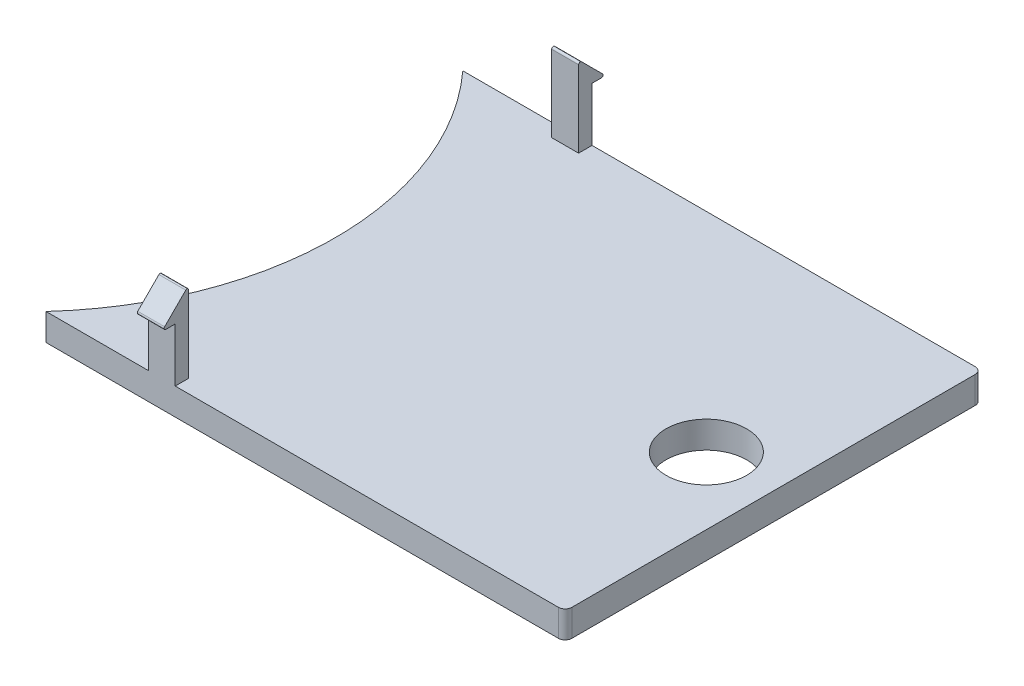
from build123d import *

# Parameters (mm, degrees)
EXTRUDE_1_DEPTH        = 4
EXTRUDE_970_DEPTH      = 2
FILLET_1_R             = 0.25
FILLET_1_OF_MIRROR_1_R = 0.25
SKETCH_4_R             = 6
CUT_EXTRUDE_2_DEPTH    = 53.927628586


with BuildPart() as part:
    # 草图1 → 凸台-拉伸1 (new body)
    with BuildSketch(Plane(origin=(0, 0, 0), x_dir=(1, 0, 0), z_dir=(0, 1, 0))):
        with BuildLine():
            ThreePointArc((38.61, 30), (38.317106781, 30.707106781), (37.61, 31))
            Line((37.61, 31), (-38.61, 31))
            ThreePointArc((-38.61, 31), (-26.595290936, 0), (-38.61, -31))
            Line((-38.61, -31), (37.61, -31))
            ThreePointArc((37.61, -31), (38.317106781, -30.707106781), (38.61, -30))
            Line((38.61, -30), (38.61, 30))
        make_face()
    extrude(amount=EXTRUDE_1_DEPTH)

    # 草图3 → Extrude 970 (add, symmetric)
    with BuildSketch(Plane(origin=(-21.39, 0, 0), x_dir=(0, 0, -1), z_dir=(1, 0, 0))):
        Polygon((-31, 4), (-31, 12), (-33, 12), (-29, 16), (-29, 4), align=None)
    extrude_970 = extrude(amount=EXTRUDE_970_DEPTH, both=True)

    # 圆角1
    fillet_1_edges = [part.edges().sort_by_distance(p)[0] for p in [
        (-21.39, 16, 29),
        (-21.39, 12, 33),
    ]]
    fillet(fillet_1_edges, radius=FILLET_1_R)

    # 镜向1: Extrude 970 across plane
    add(extrude_970.mirror(Plane.XY))

    # 圆角1 of 镜向1
    fillet_1_of_mirror_1_edges = [part.edges().sort_by_distance(p)[0] for p in [
        (-21.39, 16, -29),
        (-21.39, 12, -33),
    ]]
    fillet(fillet_1_of_mirror_1_edges, radius=FILLET_1_OF_MIRROR_1_R)

    # 草图4 → 切除-拉伸2 (cut, through all)
    with BuildSketch(Plane.XZ):
        with Locations((28.61, 0)):
            Circle(SKETCH_4_R)
    extrude(amount=-CUT_EXTRUDE_2_DEPTH, mode=Mode.SUBTRACT)


solid = part.part
